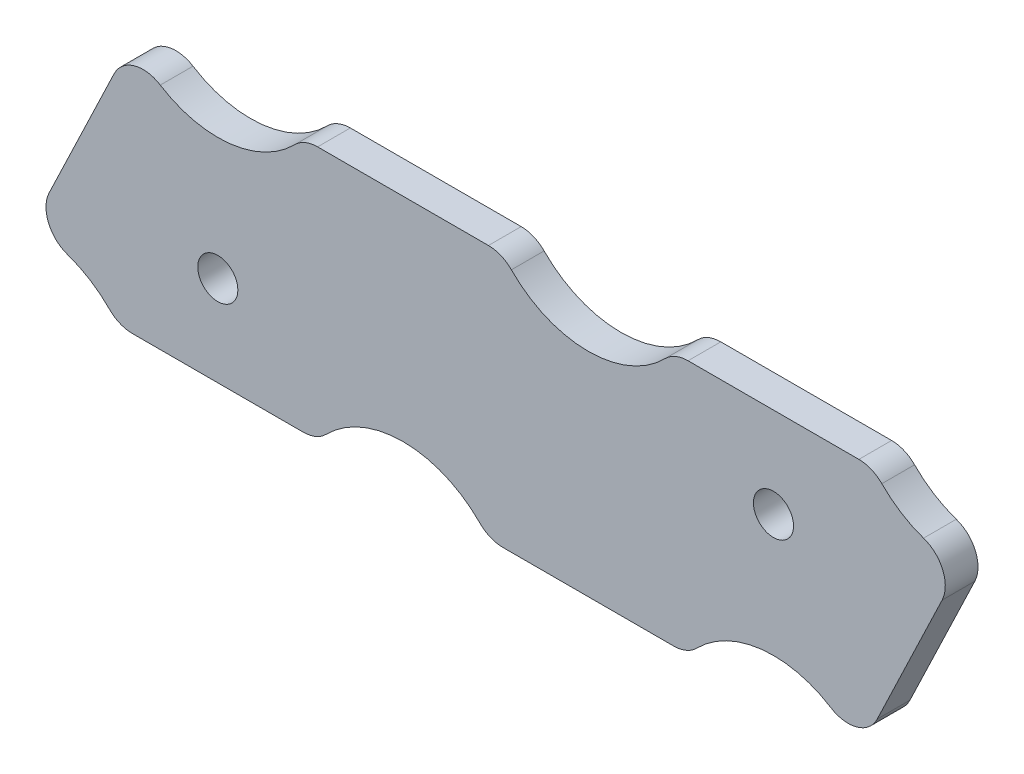
from build123d import *

# Parameters (mm, degrees)
BOSS_EXTRUDE1_DEPTH = 2.032
FILLET1_R           = 2
SKETCH4_R           = 1.2446
CUT_EXTRUDE1_DEPTH  = 75.115872934


with BuildPart() as part:
    # Sketch3 → Boss-Extrude1 (new body)
    with BuildSketch(Plane.XY):
        with BuildLine():
            ThreePointArc((10.658308864, 17.473983742), (13.670205209, 16.817167392), (16.069205037, 14.88126266))
            Line((16.069205037, 14.88126266), (28.480794963, 14.88126266))
            ThreePointArc((28.480794963, 14.88126266), (33.775, 17.475), (39.069205037, 14.88126266))
            Line((39.069205037, 14.88126266), (51.480794963, 14.88126266))
            ThreePointArc((51.480794963, 14.88126266), (56.775, 17.475), (62.069205037, 14.88126266))
            Line((62.069205037, 14.88126266), (68.391691136, 28.076016258))
            ThreePointArc((68.391691136, 28.076016258), (65.379794791, 28.732832608), (62.980794963, 30.66873734))
            Line((62.980794963, 30.66873734), (50.569205037, 30.66873734))
            ThreePointArc((50.569205037, 30.66873734), (45.275, 28.075), (39.980794963, 30.66873734))
            Line((39.980794963, 30.66873734), (27.569205037, 30.66873734))
            ThreePointArc((27.569205037, 30.66873734), (22.275, 28.075), (16.980794963, 30.66873734))
            Line((16.980794963, 30.66873734), (10.658308864, 17.473983742))
        make_face()
    extrude(amount=BOSS_EXTRUDE1_DEPTH)

    # Fillet1
    fillet1_edges = [part.edges().sort_by_distance(p)[0] for p in [
        (62.980794963, 30.66873734, 1.016),
        (50.569205037, 30.66873734, 1.016),
        (39.980794963, 30.66873734, 1.016),
        (27.569205037, 30.66873734, 1.016),
        (16.069205037, 14.88126266, 1.016),
        (28.480794963, 14.88126266, 1.016),
        (39.069205037, 14.88126266, 1.016),
        (51.480794963, 14.88126266, 1.016),
        (68.391691136, 28.076016258, 1.016),
        (62.069205037, 14.88126266, 1.016),
        (10.658308864, 17.473983742, 1.016),
        (16.980794963, 30.66873734, 1.016),
    ]]
    fillet(fillet1_edges, radius=FILLET1_R)

    # Sketch4 → Cut-Extrude1 (cut, through all)
    with BuildSketch(Plane.XY.offset(2.032)):
        with Locations((22.275, 20.49206771)):
            Circle(SKETCH4_R)
        with Locations((56.775, 25.05793229)):
            Circle(SKETCH4_R)
    extrude(amount=-CUT_EXTRUDE1_DEPTH, mode=Mode.SUBTRACT)


solid = part.part
